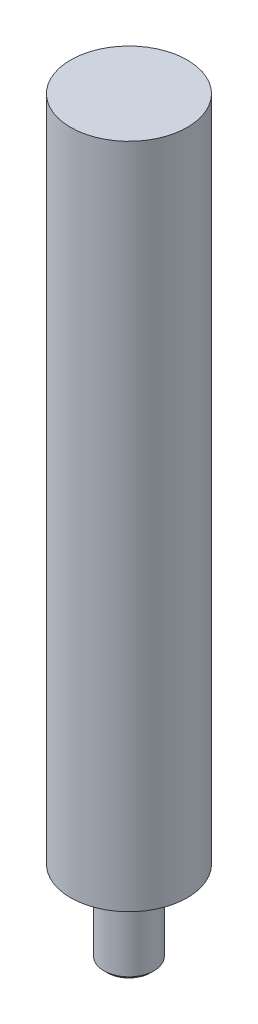
from build123d import *

# Parameters (mm, degrees)
SKETCH1_R           = 14
BOSS_EXTRUDE1_DEPTH = 160
SKETCH2_R           = 10
BOSS_EXTRUDE2_DEPTH = 20


# Read off the part's stored shape, not the designer's step: M12x1.5 Machine Threads Stud1
with BuildPart() as part:
    # Sketch1 → Boss-Extrude1 (new body)
    with BuildSketch(Plane(origin=(0, 0, 0), x_dir=(1, 0, 0), z_dir=(0, 1, 0))):
        with Locations(Location((0, 0, 0), (0, 0, 270))):
            Circle(SKETCH1_R)
    extrude(amount=BOSS_EXTRUDE1_DEPTH)

    # Sketch2 → Boss-Extrude2 (add)
    with BuildSketch(Plane.XZ):
        with Locations(Location((0, 0, 0), (0, 0, 270))):
            Circle(SKETCH2_R)
    extrude(amount=BOSS_EXTRUDE2_DEPTH)

    # M12x1.5 Machine Threads Stud1 outline → M12x1.5 Machine Threads Stud1 (revolve, cut)
    with BuildSketch(Plane.XY):
        Polygon((10, 0), (6, 0), (6, -19.172), (5.172, -20), (10, -20), align=None)
    revolve(axis=Axis((0, 0, 0), (0, 1, 0)), mode=Mode.SUBTRACT)


solid = part.part
